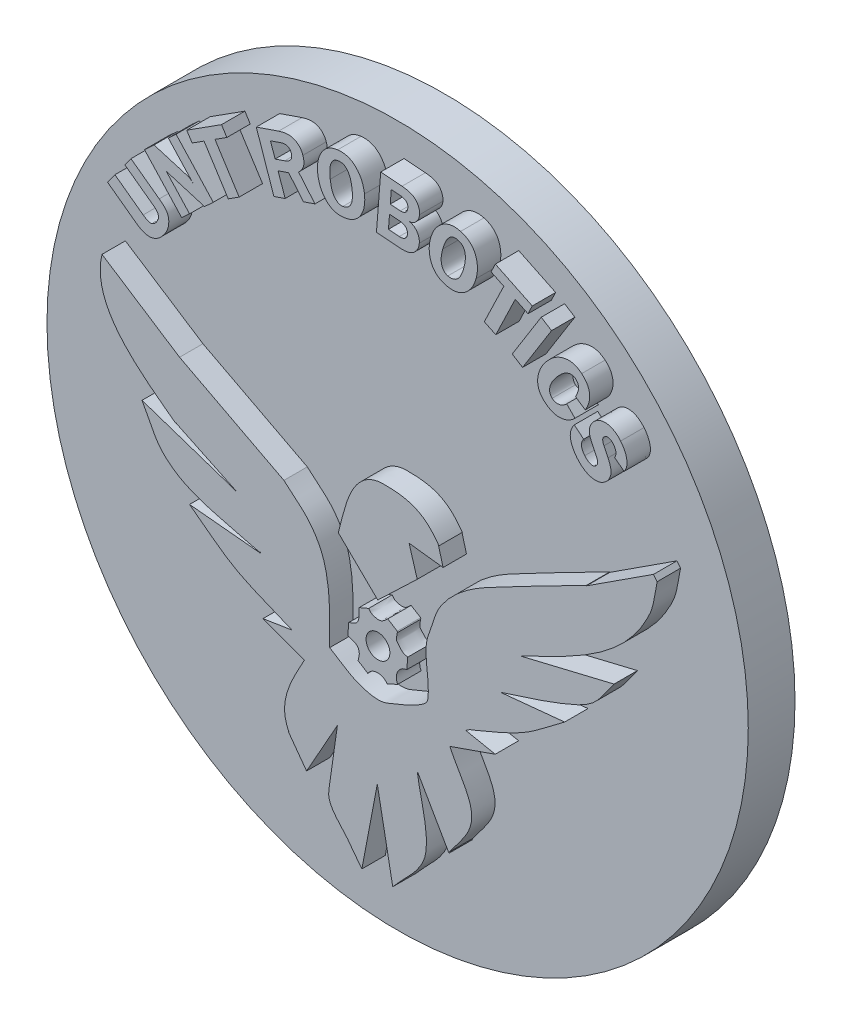
from build123d import *

# Parameters (mm, degrees)
SKETCH2_R           = 38.1
BOSS_EXTRUDE1_DEPTH = 5.08
SKETCH3_R           = 1.292496353
BOSS_EXTRUDE3_DEPTH = 7.62
BOSS_EXTRUDE4_START = 5.08
BOSS_EXTRUDE4_DEPTH = 2.54


# Read off the part's stored shape, not the designer's step: Boss-Extrude4
with BuildPart() as part:
    # Sketch2 → Boss-Extrude1 (new body)
    with BuildSketch(Plane.XY):
        Circle(SKETCH2_R)
    extrude(amount=BOSS_EXTRUDE1_DEPTH)

    # Sketch3 → Boss-Extrude3 (add)
    # profile 1 of 3: a face of its own
    with BuildSketch(Plane.XY):
        with BuildLine():
            Line((-29.579789435, 11.994593958), (-21.152724585, 6.524393967))
            Line((-21.152724585, 6.524393967), (-9.818075955, 0.610664247))
            add(Edge.make_bspline(
                [(-9.818075955, 0.610664247), (-8.832454335, -0.309249265), (-7.680186055, -1.078109033), (-6.861211095, -2.149076289), (-6.160574134, -3.065293853), (-5.62149609, -4.136912136), (-5.333497584, -5.253784392), (-4.716872773, -7.645085486), (-4.840686774, -10.176422886), (-4.840686774, -12.645946541)],
                knots=[0, 0, 0, 0, 1, 1, 1, 2, 2, 2, 3, 3, 3, 3], degree=3))
            add(Edge.make_bspline(
                [(-4.840686774, -12.645946541), (-3.740075965, -13.270173567), (-2.734323061, -14.10406992), (-1.538854347, -14.518627619), (-0.590080751, -14.847637818), (0.546369201, -15.116152984), (1.467291594, -14.715751943), (2.279139107, -14.362774764), (5.653781526, -13.159701472), (5.804026722, -12.251697893), (6.141960653, -10.209401527), (5.16459689, -7.976329672), (5.902588884, -6.042281688), (6.331063426, -4.919382888), (6.564686585, -3.689973106), (7.233178071, -2.69116818), (9.311738136, 0.414445094), (12.517591351, 1.658257001), (15.709524003, 3.370404783), (18.137433855, 4.672731907), (20.588132004, 5.932911487), (23.052405072, 7.16504802)],
                knots=[0, 0, 0, 0, 1, 1, 1, 2, 2, 2, 3, 3, 3, 4, 4, 4, 5, 5, 5, 6, 6, 6, 7, 7, 7, 7], degree=3))
            Line((23.052405072, 7.16504802), (23.052405072, 7.115766939))
            Line((23.052405072, 7.115766939), (30.34600506, 11.846750715))
            Line((30.34600506, 11.846750715), (30.740253708, 11.353939905))
            add(Edge.make_bspline(
                [(30.740253708, 11.353939905), (30.477421276, 10.220475042), (30.427069176, 9.015572274), (29.951756412, 7.953545316), (27.30947276, 2.049692783), (21.252470912, -0.467924161), (15.808086165, -3.085416828)],
                knots=[0, 0, 0, 0, 1, 1, 1, 2, 2, 2, 2], degree=3))
            Line((15.808086165, -3.085416828), (26.058551013, -0.621362778))
            add(Edge.make_bspline(
                [(26.058551013, -0.621362778), (25.270053717, -1.606984398), (24.67788619, -2.788738172), (23.693059125, -3.578227638), (22.64409805, -4.419130317), (21.344216773, -4.903387233), (20.095540212, -5.401627635), (18.00156407, -6.237155061), (15.824513192, -6.847206011), (13.688999682, -7.569995199)],
                knots=[0, 0, 0, 0, 1, 1, 1, 2, 2, 2, 3, 3, 3, 3], degree=3))
            Line((13.688999682, -7.569995199), (20.686913184, -6.880060065))
            add(Edge.make_bspline(
                [(20.686913184, -6.880060065), (19.126345619, -7.997097901), (17.670505251, -9.277266864), (16.005210489, -10.231173572), (14.269890966, -11.225191552), (12.358410495, -11.873876272), (10.535010498, -12.695227622)],
                knots=[0, 0, 0, 0, 1, 1, 1, 2, 2, 2, 2], degree=3))
            Line((10.535010498, -12.695227622), (10.535010498, -12.645946541))
            Line((10.535010498, -12.645946541), (9.943637526, -13.040195189))
            Line((9.943637526, -13.040195189), (13.146907791, -13.680849242))
            Line((13.146907791, -13.680849242), (8.218799691, -15.405687077))
            add(Edge.make_bspline(
                [(8.218799691, -15.405687077), (9.346089072, -17.942088186), (11.523950006, -19.923386326), (10.14076185, -22.551443822), (9.597337501, -23.583950085), (8.793745636, -24.456978954), (8.120237529, -25.40974652)],
                knots=[0, 0, 0, 0, 1, 1, 1, 2, 2, 2, 2], degree=3))
            Line((8.120237529, -25.40974652), (8.070956448, -25.40974652))
            Line((8.070956448, -25.40974652), (8.120237529, -25.508308682))
            Line((8.120237529, -25.508308682), (4.670561859, -19.4960168))
            add(Edge.make_bspline(
                [(4.670561859, -19.4960168), (4.982675372, -21.877935715), (5.906233069, -24.258214502), (5.606902398, -26.641773545), (5.348495949, -28.69945453), (3.322619265, -30.112658935), (2.009383485, -31.717724888)],
                knots=[0, 0, 0, 0, 1, 1, 1, 2, 2, 2, 2], degree=3))
            Line((2.009383485, -31.717724888), (0.333826731, -22.896411389))
            Line((0.333826731, -22.896411389), (-1.341730023, -31.717724888))
            add(Edge.make_bspline(
                [(-1.341730023, -31.717724888), (-1.752405698, -31.175632997), (-2.190303981, -30.653126947), (-2.573757048, -30.091449215), (-3.429932635, -28.837332863), (-5.118507738, -27.706126684), (-4.939248936, -26.198243816), (-4.674875738, -23.974398684), (-4.31502191, -21.762946526), (-4.002908397, -19.545297881)],
                knots=[0, 0, 0, 0, 1, 1, 1, 2, 2, 2, 3, 3, 3, 3], degree=3))
            Line((-4.002908397, -19.545297881), (-7.354021905, -25.508308682))
            Line((-7.354021905, -25.508308682), (-9.325265145, -22.797849227))
            Line((-9.325265145, -22.797849227), (-9.275984064, -22.797849227))
            add(Edge.make_bspline(
                [(-9.275984064, -22.797849227), (-10.581822269, -20.186172817), (-8.826145229, -17.537426801), (-7.60042731, -15.208562753)],
                knots=[0, 0, 0, 0, 1, 1, 1, 1], degree=3))
            Line((-7.60042731, -15.208562753), (-12.085005681, -13.533005999))
            Line((-12.085005681, -13.533005999), (-8.931016497, -13.040195189))
            add(Edge.make_bspline(
                [(-8.931016497, -13.040195189), (-10.984394872, -12.136708704), (-13.135434511, -11.428744907), (-15.091151622, -10.329735734), (-16.867447744, -9.33155163), (-18.409411076, -7.964243847), (-20.068540803, -6.781497903)],
                knots=[0, 0, 0, 0, 1, 1, 1, 2, 2, 2, 2], degree=3))
            Line((-20.068540803, -6.781497903), (-12.380692167, -7.520714118))
            Line((-12.380692167, -7.520714118), (-12.371497121, -7.402679297))
            add(Edge.make_bspline(
                [(-12.371497121, -7.402679297), (-12.420778202, -7.419106324), (-12.468495303, -7.462602367), (-12.519340364, -7.451960378), (-13.182278851, -7.313205811), (-13.836706952, -7.135743992), (-14.490583604, -6.959149568), (-17.354616174, -6.185651721), (-20.684874928, -5.68059061), (-22.917648455, -3.410911736), (-23.966733646, -2.344486294), (-24.461788993, -0.848295524), (-25.233859262, 0.433012582)],
                knots=[0, 0, 0, 0, 1, 1, 1, 2, 2, 2, 3, 3, 3, 4, 4, 4, 4], degree=3))
            Line((-25.233859262, 0.433012582), (-14.894027298, -3.036135747))
            Line((-14.894027298, -3.036135747), (-21.497692152, 0.117853437))
            Line((-21.497692152, 0.117853437), (-21.497692152, 0.167134518))
            Line((-21.497692152, 0.167134518), (-21.596254314, 0.117853437))
            add(Edge.make_bspline(
                [(-21.596254314, 0.117853437), (-25.210184702, 2.838452718), (-30.876146829, 6.623970472), (-29.579789435, 11.994593958)],
                knots=[0, 0, 0, 0, 1, 1, 1, 1], degree=3))
        make_face()
    # profile 2 of 3: a face of its own
    with BuildSketch(Plane.XY):
        with BuildLine():
            Line((7.036053747, 2.877593973), (6.986772666, 2.877593973))
            Line((6.986772666, 2.877593973), (7.479583476, 1.054193976))
            Line((7.479583476, 1.054193976), (3.783502401, 1.497723705))
            Line((3.783502401, 1.497723705), (4.670561859, -1.459141155))
            Line((4.670561859, -1.459141155), (0.383107812, -5.549470878))
            Line((0.383107812, -5.549470878), (-3.904346235, -1.360578993))
            add(Edge.make_bspline(
                [(-3.904346235, -1.360578993), (-3.212855949, 1.185362513), (-2.58298743, 5.752485635), (1.171605108, 5.68661559), (3.858933067, 5.639469486), (5.446132093, 5.148910621), (7.036053747, 2.877593973)],
                knots=[0, 0, 0, 0, 1, 1, 1, 2, 2, 2, 2], degree=3))
        make_face()
    # profile 3 of 3: a face of its own
    with BuildSketch(Plane.XY):
        with BuildLine():
            Line((1.467291594, -6.781497903), (2.502194295, -7.422151956))
            Line((2.502194295, -7.422151956), (2.452913214, -7.422151956))
            Line((2.452913214, -7.422151956), (2.551475376, -7.520714118))
            add(Edge.make_bspline(
                [(2.551475376, -7.520714118), (2.535048349, -7.537141145), (2.504908672, -7.546922995), (2.502194295, -7.569995199), (2.467645917, -7.863656411), (2.308540186, -8.233607607), (2.502194295, -8.457054656), (2.692532681, -8.67667587), (2.859854561, -8.924964535), (3.093567267, -9.097708709), (3.248188965, -9.211994312), (3.454961861, -9.229124925), (3.635659158, -9.294833033)],
                knots=[0, 0, 0, 0, 1, 1, 1, 2, 2, 2, 3, 3, 3, 4, 4, 4, 4], degree=3))
            Line((3.635659158, -9.294833033), (3.537096996, -10.526860058))
            ThreePointArc((3.537096996, -10.526860058), (2.546876855, -11.201406213), (2.551475376, -12.399541136))
            Line((2.551475376, -12.399541136), (1.418010513, -12.941633027))
            ThreePointArc((1.418010513, -12.941633027), (0.345260372, -12.398376883), (-0.70107597, -12.990914108))
            Line((-0.70107597, -12.990914108), (-1.785259752, -12.300978974))
            add(Edge.make_bspline(
                [(-1.785259752, -12.300978974), (-1.768832725, -12.284551947), (-1.740015934, -12.27457572), (-1.735978671, -12.251697893), (-1.689946785, -11.99085054), (-1.590853462, -11.723953659), (-1.637416509, -11.463200597), (-1.769494749, -10.723562451), (-2.254472199, -10.809705185), (-2.820162453, -10.526860058), (-2.853016507, -10.510433031), (-2.870855257, -10.465002707), (-2.869443534, -10.428297896), (-2.854238807, -10.032974988), (-2.803735426, -9.6398006), (-2.770881372, -9.245551952)],
                knots=[0, 0, 0, 0, 1, 1, 1, 2, 2, 2, 3, 3, 3, 4, 4, 4, 5, 5, 5, 5], degree=3))
            add(Edge.make_bspline(
                [(-2.770881372, -9.245551952), (-2.200412948, -8.995972017), (-1.828038038, -9.02481175), (-1.68669759, -8.358492494), (-1.611629261, -8.004598943), (-1.653843536, -7.635703307), (-1.637416509, -7.274308713)],
                knots=[0, 0, 0, 0, 1, 1, 1, 2, 2, 2, 2], degree=3))
            Line((-1.637416509, -7.274308713), (-0.602513808, -6.830778984))
            add(Edge.make_bspline(
                [(-0.602513808, -6.830778984), (-0.487524619, -6.945768173), (-0.406394104, -7.110253491), (-0.257546241, -7.175746551), (0.562591206, -7.536607027), (0.867150219, -7.381639278), (1.467291594, -6.781497903)],
                knots=[0, 0, 0, 0, 1, 1, 1, 2, 2, 2, 2], degree=3))
        make_face()
        with Locations(Location((0.404121802, -9.871569397, 0), (0, 0, 180))):
            Circle(SKETCH3_R, mode=Mode.SUBTRACT)
    extrude(amount=BOSS_EXTRUDE3_DEPTH)

    # Boss-Extrude4 outline → Boss-Extrude4 (add)
    # profile 1 of 11: a face of its own
    with BuildSketch(Plane.XY.offset(BOSS_EXTRUDE4_START)):
        with BuildLine():
            add(Edge.make_bspline(
                [(-23.680980567, 17.961880263), (-23.640735418, 18.020268201), (-23.563844323, 18.131822326), (-23.4872939, 18.31258876), (-23.443722883, 18.490661481), (-23.441334989, 18.639434116), (-23.459993479, 18.757704652), (-23.495267313, 18.847211567), (-23.543719382, 18.938714431), (-23.607878264, 19.032434303), (-23.690503699, 19.125491889), (-23.78690154, 19.222404645), (-23.900716264, 19.320062574), (-23.983893094, 19.383085736), (-24.027391408, 19.416044449)],
                knots=[0, 0, 0, 0, 0.122556034, 0.234151634, 0.337941542, 0.438326796, 0.489639227, 0.544348943, 0.603996729, 0.668823775, 0.740504836, 0.81925141, 0.905475371, 1, 1, 1, 1], degree=3))
            add(Edge.make_bspline(
                [(-25.107228862, 17.941577796), (-25.058888816, 17.90730741), (-24.966985635, 17.842153198), (-24.831057702, 17.755800973), (-24.702979004, 17.688638996), (-24.583923333, 17.636855363), (-24.47382056, 17.600125667), (-24.37164163, 17.581223344), (-24.277908015, 17.580757148), (-24.166305715, 17.601684928), (-24.041280698, 17.655182209), (-23.903134863, 17.734301983), (-23.781683311, 17.837839311), (-23.714857026, 17.920152818), (-23.680980567, 17.961880263)],
                knots=[0, 0, 0, 0, 0.10811187, 0.205540245, 0.29356548, 0.371693945, 0.442226528, 0.504903624, 0.560468589, 0.612238188, 0.710978135, 0.80680396, 0.902062523, 1, 1, 1, 1], degree=3))
            Line((-25.107228862, 17.941577796), (-28.177976969, 20.187538189))
            Line((-28.177976969, 20.187538189), (-28.982462217, 19.087398268))
            Line((-28.982462217, 19.087398268), (-25.849537805, 16.795757325))
            add(Edge.make_bspline(
                [(-22.847310524, 17.215764607), (-22.883158849, 17.167975521), (-22.953399365, 17.074338512), (-23.065410964, 16.943936562), (-23.178794835, 16.824010882), (-23.293435231, 16.71431137), (-23.412482597, 16.61832524), (-23.531116999, 16.5307716), (-23.654095836, 16.457352651), (-23.777736194, 16.393837711), (-23.902980441, 16.341445837), (-24.028214115, 16.299924041), (-24.153094224, 16.267315104), (-24.278457545, 16.247250208), (-24.403628137, 16.237001801), (-24.529222586, 16.2371499), (-24.654547282, 16.246805368), (-24.780043897, 16.26907766), (-24.90605839, 16.301546412), (-25.034957713, 16.341663153), (-25.16498662, 16.394309062), (-25.297601078, 16.455954821), (-25.433314621, 16.525050847), (-25.570525973, 16.605818404), (-25.710394095, 16.695766754), (-25.802454079, 16.761922316), (-25.849537805, 16.795757325)],
                knots=[0, 0, 0, 0, 0.051469454, 0.100848252, 0.148031205, 0.19366835, 0.237445239, 0.279732496, 0.320614041, 0.360714694, 0.399434909, 0.437471442, 0.474335537, 0.510528608, 0.546730855, 0.582450988, 0.618653235, 0.654906822, 0.692124206, 0.730741351, 0.771148939, 0.812898691, 0.856749869, 0.902322925, 0.950043433, 1, 1, 1, 1], degree=3))
            add(Edge.make_bspline(
                [(-23.363754523, 20.32457984), (-23.31491398, 20.288044668), (-23.219578085, 20.216728645), (-23.083880044, 20.10835118), (-22.960913968, 20.00009583), (-22.848676685, 19.894805479), (-22.747920701, 19.791302908), (-22.660746564, 19.687653608), (-22.582268634, 19.588157646), (-22.516536193, 19.487514414), (-22.460598244, 19.384269112), (-22.414945838, 19.274526474), (-22.378490725, 19.157651591), (-22.350059145, 19.033870889), (-22.332975887, 18.902582757), (-22.324166074, 18.763974532), (-22.324434586, 18.618186814), (-22.333403002, 18.466514701), (-22.351154404, 18.31089426), (-22.385472414, 18.154763732), (-22.429357452, 17.997432303), (-22.488401244, 17.841017464), (-22.55833948, 17.68337092), (-22.642469101, 17.527123535), (-22.737808144, 17.369383643), (-22.81024966, 17.267756665), (-22.847310524, 17.215764607)],
                knots=[0, 0, 0, 0, 0.050543906, 0.098660829, 0.143867043, 0.186267102, 0.226177499, 0.263473421, 0.29845771, 0.331122863, 0.362957538, 0.395635852, 0.429446849, 0.464309771, 0.500744216, 0.539028454, 0.579337045, 0.621469685, 0.664901757, 0.708967088, 0.753791208, 0.800148656, 0.847375176, 0.896611467, 0.947106736, 1, 1, 1, 1], degree=3))
            Line((-23.363754523, 20.32457984), (-26.43450263, 22.570540232))
            Line((-26.43450263, 22.570540232), (-27.098139515, 21.662004842))
            Line((-27.098139515, 21.662004842), (-24.027391408, 19.416044449))
        make_face()
    # profile 2 of 11: a face of its own
    with BuildSketch(Plane.XY.offset(BOSS_EXTRUDE4_START)):
        with BuildLine():
            add(Edge.make_bspline(
                [(-20.093733597, 23.971069106), (-20.088181111, 23.968200148), (-20.072615204, 23.960157277), (-20.045051926, 23.940475081), (-20.007511207, 23.909763655), (-19.958804463, 23.868779321), (-19.899734475, 23.817002693), (-19.829998695, 23.754761662), (-19.749687151, 23.682408557), (-19.693512287, 23.629835623), (-19.663575082, 23.601817991)],
                knots=[0, 0, 0, 0, 0.033000081, 0.092512812, 0.178380533, 0.28941539, 0.428815, 0.593451701, 0.783338686, 1, 1, 1, 1], degree=3))
            Line((-20.093733597, 23.971069106), (-23.92582421, 25.113082865))
            Line((-23.92582421, 25.113082865), (-24.963787827, 24.156329116))
            Line((-24.963787827, 24.156329116), (-20.922328025, 19.772265186))
            Line((-20.922328025, 19.772265186), (-20.06708661, 20.561523584))
            Line((-20.06708661, 20.561523584), (-22.592560786, 23.301668695))
            add(Edge.make_bspline(
                [(-22.5858614, 23.299818797), (-22.588094555, 23.300435337), (-22.590327711, 23.301051877), (-22.592560786, 23.301668695)],
                knots=[0, 0, 0, 0, 0.02165875, 0.02165875, 0.02165875, 0.02165875], degree=3))
            Line((-22.5858614, 23.299818797), (-18.440351456, 22.060099416))
            Line((-18.440351456, 22.060099416), (-17.489942227, 22.936912202))
            Line((-17.489942227, 22.936912202), (-21.531402029, 27.320976132))
            Line((-21.531402029, 27.320976132), (-22.375223307, 26.543137872))
            Line((-22.375223307, 26.543137872), (-19.663575082, 23.601817991))
        make_face()
    # profile 3 of 11: a face of its own
    with BuildSketch(Plane.XY.offset(BOSS_EXTRUDE4_START)):
        with BuildLine():
            add(Edge.make_bspline(
                [(-7.754024273, 32.22764358), (-7.739406194, 32.183422638), (-7.710710999, 32.096617209), (-7.679644881, 31.965341635), (-7.656059023, 31.837516427), (-7.643695462, 31.712326263), (-7.639224509, 31.58975969), (-7.645913617, 31.469690174), (-7.660981533, 31.352582324), (-7.685222047, 31.238312544), (-7.719481979, 31.126589822), (-7.764000215, 31.017627221), (-7.817839956, 30.911770025), (-7.880066173, 30.808318), (-7.952914435, 30.708314733), (-8.034375614, 30.610103607), (-8.125450658, 30.514971755), (-8.192212966, 30.45579698), (-8.226056626, 30.425799649)],
                knots=[0, 0, 0, 0, 0.069966025, 0.137342863, 0.20255891, 0.265179739, 0.326235494, 0.386709356, 0.445687968, 0.503538989, 0.56205329, 0.62107642, 0.680208992, 0.74038812, 0.802314618, 0.865962742, 0.932052807, 1, 1, 1, 1], degree=3))
            add(Edge.make_bspline(
                [(-10.388269343, 33.186935137), (-10.301922916, 33.215223599), (-10.134537932, 33.270061579), (-9.885880792, 33.329665367), (-9.649991824, 33.367687334), (-9.427285216, 33.388895719), (-9.216376316, 33.384492584), (-9.017833193, 33.361657719), (-8.832033861, 33.315645804), (-8.660032082, 33.249084637), (-8.501379624, 33.165904093), (-8.354076061, 33.070729602), (-8.220942445, 32.961258153), (-8.100475249, 32.839756896), (-7.99339317, 32.705686663), (-7.89905273, 32.558603024), (-7.817320452, 32.398912721), (-7.775304389, 32.285224106), (-7.754024273, 32.22764358)],
                knots=[0, 0, 0, 0, 0.08587749, 0.166475936, 0.241420157, 0.311655801, 0.377646951, 0.440489253, 0.500232222, 0.558082337, 0.61442148, 0.669323163, 0.723596508, 0.777038528, 0.830808673, 0.88549294, 0.942004951, 1, 1, 1, 1], degree=3))
            Line((-10.388269343, 33.186935137), (-12.816951937, 32.353265093))
            Line((-12.816951937, 32.353265093), (-10.903444439, 26.777700142))
            Line((-10.903444439, 26.777700142), (-9.684027525, 27.19643852))
            Line((-9.684027525, 27.19643852), (-10.447907839, 29.420827542))
            Line((-10.447907839, 29.420827542), (-9.295742847, 29.81545674))
            Line((-9.295742847, 29.81545674), (-7.691847968, 27.880377871))
            Line((-7.691847968, 27.880377871), (-6.44070845, 28.309267483))
            Line((-6.44070845, 28.309267483), (-8.226056626, 30.425799649))
        make_face()
        with BuildLine():
            add(Edge.make_bspline(
                [(-9.720825746, 30.725261035), (-9.680942681, 30.739723462), (-9.603833827, 30.767684734), (-9.494055602, 30.813775479), (-9.396353701, 30.866486699), (-9.308403933, 30.920850564), (-9.230129394, 30.977886607), (-9.162486097, 31.03907121), (-9.104506089, 31.103601151), (-9.044603816, 31.194966644), (-8.988618278, 31.316330728), (-8.961562899, 31.474397768), (-8.966945941, 31.641066133), (-8.999585421, 31.749760048), (-9.016583928, 31.806367393)],
                knots=[0, 0, 0, 0, 0.086628455, 0.167485143, 0.242826307, 0.313043056, 0.378510111, 0.44026593, 0.499007129, 0.555058234, 0.662918261, 0.769133709, 0.879765782, 1, 1, 1, 1], degree=3))
            Line((-9.720825746, 30.725261035), (-10.771478404, 30.364892249))
            Line((-10.771478404, 30.364892249), (-11.275233362, 31.831745477))
            Line((-11.275233362, 31.831745477), (-10.145908645, 32.218761251))
            add(Edge.make_bspline(
                [(-9.016583928, 31.806367393), (-9.036356278, 31.856595809), (-9.074700327, 31.954002589), (-9.168386005, 32.078505455), (-9.283672512, 32.17909334), (-9.398470397, 32.238919779), (-9.498916251, 32.272306724), (-9.579708467, 32.289985701), (-9.664258725, 32.3007402), (-9.75314744, 32.299661649), (-9.845600795, 32.29210831), (-9.942769638, 32.276637519), (-10.043867059, 32.252884768), (-10.111386732, 32.230305653), (-10.145908645, 32.218761251)],
                knots=[0, 0, 0, 0, 0.118914062, 0.23060723, 0.340694581, 0.454928492, 0.514090449, 0.574460291, 0.637579473, 0.702124327, 0.770641179, 0.842614806, 0.919531039, 1, 1, 1, 1], degree=3))
        make_face(mode=Mode.SUBTRACT)
    # profile 4 of 11: a face of its own
    with BuildSketch(Plane.XY.offset(BOSS_EXTRUDE4_START)):
        with BuildLine():
            add(Edge.make_bspline(
                [(-1.06140171, 31.933726888), (-1.050525044, 31.825977007), (-1.029193046, 31.614651202), (-1.024480756, 31.301533947), (-1.042602357, 31.000566275), (-1.086480415, 30.71162396), (-1.151430593, 30.434749011), (-1.242269802, 30.170056495), (-1.357293819, 29.918077397), (-1.493029915, 29.678782062), (-1.651241798, 29.458068928), (-1.829335507, 29.259775021), (-2.027686582, 29.08767507), (-2.24395706, 28.938826162), (-2.479971124, 28.815242928), (-2.735428383, 28.718359685), (-3.008895659, 28.642779751), (-3.199513616, 28.615543759), (-3.297210869, 28.60158452)],
                knots=[0, 0, 0, 0, 0.071939691, 0.141092622, 0.20784005, 0.272077221, 0.335070038, 0.396579298, 0.457711074, 0.518895167, 0.579113559, 0.637820007, 0.695593874, 0.753208215, 0.811920719, 0.872157475, 0.934476983, 1, 1, 1, 1], degree=3))
            add(Edge.make_bspline(
                [(-3.982419124, 34.627610454), (-3.883968578, 34.636721882), (-3.691519013, 34.654532755), (-3.407197103, 34.648349798), (-3.13645771, 34.611666328), (-2.87939064, 34.545707154), (-2.636209392, 34.449472481), (-2.405859496, 34.324696674), (-2.190765392, 34.167785802), (-1.989603949, 33.985275492), (-1.806217131, 33.780461953), (-1.640036768, 33.559785876), (-1.494153417, 33.324219453), (-1.366599817, 33.07492643), (-1.259992847, 32.810585197), (-1.172298552, 32.531945735), (-1.104750997, 32.238227376), (-1.076009763, 32.036338935), (-1.06140171, 31.933726888)],
                knots=[0, 0, 0, 0, 0.066411454, 0.129820056, 0.190646971, 0.249666808, 0.307734204, 0.365995414, 0.42524756, 0.48622839, 0.548223167, 0.609739667, 0.67166271, 0.734212899, 0.797717649, 0.86299013, 0.930363208, 1, 1, 1, 1], degree=3))
            add(Edge.make_bspline(
                [(-6.140825128, 31.3297285), (-6.15131364, 31.433675597), (-6.171956081, 31.638253903), (-6.174872615, 31.941637432), (-6.157000427, 32.234988281), (-6.1129987, 32.517482573), (-6.048756481, 32.790794326), (-5.960145106, 33.054085109), (-5.845724767, 33.305914617), (-5.7129399, 33.546793542), (-5.557354618, 33.768915092), (-5.385043968, 33.969616322), (-5.193721775, 34.144262577), (-4.985414128, 34.292973349), (-4.759034276, 34.416223617), (-4.515805636, 34.513509391), (-4.255483611, 34.587176302), (-4.07460173, 34.613960472), (-3.982419124, 34.627610454)],
                knots=[0, 0, 0, 0, 0.070984718, 0.13970504, 0.205972839, 0.270544299, 0.333794556, 0.396619949, 0.45903348, 0.521586582, 0.583320961, 0.643040756, 0.701041594, 0.758962567, 0.816602422, 0.875811351, 0.936709895, 1, 1, 1, 1], degree=3))
            add(Edge.make_bspline(
                [(-3.297210869, 28.60158452), (-3.392707528, 28.59288319), (-3.579282573, 28.575883107), (-3.85518653, 28.583447412), (-4.118013415, 28.62120884), (-4.368047625, 28.689219203), (-4.605175725, 28.785319697), (-4.828163289, 28.913331421), (-5.038713544, 29.068538599), (-5.232884168, 29.25363212), (-5.411977242, 29.45899846), (-5.571884977, 29.682530713), (-5.715079913, 29.919811071), (-5.839483455, 30.172214088), (-5.94332248, 30.440523992), (-6.029684431, 30.722861278), (-6.097669499, 31.02056356), (-6.126264616, 31.225417662), (-6.140825128, 31.3297285)],
                knots=[0, 0, 0, 0, 0.064956349, 0.12690741, 0.186590585, 0.244525246, 0.302131236, 0.359526375, 0.41835856, 0.479001515, 0.540979769, 0.602803991, 0.665051546, 0.728647887, 0.793282021, 0.859848275, 0.928635338, 1, 1, 1, 1], degree=3))
        make_face()
        with BuildLine():
            add(Edge.make_bspline(
                [(-4.784366564, 31.46042563), (-4.773105651, 31.377862798), (-4.751327862, 31.218192277), (-4.710257314, 30.987920574), (-4.65916968, 30.776408613), (-4.602767394, 30.581847431), (-4.536949949, 30.405423591), (-4.463722808, 30.246663901), (-4.383617525, 30.104996192), (-4.294956838, 29.981707934), (-4.199353947, 29.87600861), (-4.099587599, 29.786084717), (-3.995941119, 29.711393866), (-3.886186963, 29.655881651), (-3.77407827, 29.61196123), (-3.655639815, 29.589023282), (-3.533206399, 29.578886098), (-3.450730135, 29.586298945), (-3.408874437, 29.590060874)],
                knots=[0, 0, 0, 0, 0.096568346, 0.186756169, 0.270934166, 0.348640455, 0.42138937, 0.488938478, 0.551077296, 0.609714494, 0.664550604, 0.715925249, 0.765159927, 0.812077982, 0.858148457, 0.904198063, 0.951381685, 1, 1, 1, 1], degree=3))
            add(Edge.make_bspline(
                [(-3.879637886, 33.639134101), (-3.9259737, 33.631771041), (-4.016483943, 33.61738838), (-4.145548929, 33.577822054), (-4.263760811, 33.523184718), (-4.369906006, 33.452109983), (-4.466429116, 33.368009481), (-4.550527295, 33.267277191), (-4.624566884, 33.15236168), (-4.686397565, 33.022069321), (-4.736913679, 32.877269279), (-4.777315596, 32.718519164), (-4.806257936, 32.544920091), (-4.823161844, 32.356614519), (-4.830851665, 32.153302579), (-4.826520661, 31.935186703), (-4.810995481, 31.70237758), (-4.79343769, 31.542846429), (-4.784366564, 31.46042563)],
                knots=[0, 0, 0, 0, 0.05310124, 0.103725513, 0.152386432, 0.200096743, 0.247967999, 0.29692762, 0.34823217, 0.402454427, 0.459892659, 0.521720185, 0.587812373, 0.659045815, 0.735766581, 0.81819601, 0.906072074, 1, 1, 1, 1], degree=3))
            add(Edge.make_bspline(
                [(-2.417860275, 31.777651674), (-2.428132656, 31.855168073), (-2.448073352, 32.005642523), (-2.489025969, 32.222812062), (-2.536439037, 32.425633183), (-2.594341452, 32.613241339), (-2.656301202, 32.787973971), (-2.729711562, 32.946653274), (-2.807284314, 33.092589768), (-2.895398167, 33.222287656), (-2.989917149, 33.337335575), (-3.093361408, 33.43482916), (-3.204646296, 33.514492277), (-3.324169515, 33.576439627), (-3.452153449, 33.619655642), (-3.587943379, 33.644843356), (-3.731775773, 33.652867674), (-3.82935155, 33.643804743), (-3.879637886, 33.639134101)],
                knots=[0, 0, 0, 0, 0.088112542, 0.171043629, 0.248973844, 0.32271489, 0.392236617, 0.457727221, 0.519588382, 0.578292453, 0.634139884, 0.687088157, 0.73801502, 0.787905027, 0.838255235, 0.889677225, 0.943144412, 1, 1, 1, 1], degree=3))
            add(Edge.make_bspline(
                [(-3.408874437, 29.590060874), (-3.366772235, 29.596171298), (-3.2835601, 29.608248134), (-3.163767199, 29.645037999), (-3.050183149, 29.692803942), (-2.943858604, 29.755082824), (-2.843180864, 29.828282346), (-2.750219655, 29.916222418), (-2.662094414, 30.015205608), (-2.58099765, 30.129220689), (-2.510717524, 30.261433576), (-2.45314494, 30.414242931), (-2.412735715, 30.589240891), (-2.385293132, 30.785402959), (-2.372173636, 31.002988218), (-2.372436301, 31.242398682), (-2.388497139, 31.503204389), (-2.407821494, 31.683822586), (-2.417860275, 31.777651674)],
                knots=[0, 0, 0, 0, 0.047128285, 0.093145846, 0.13854941, 0.183534095, 0.229515765, 0.276323008, 0.325182712, 0.376342294, 0.431125532, 0.490816115, 0.556931695, 0.629918397, 0.710313366, 0.798518508, 0.895332669, 1, 1, 1, 1], degree=3))
        make_face(mode=Mode.SUBTRACT)
    # profile 5 of 11: a face of its own
    with BuildSketch(Plane.XY.offset(BOSS_EXTRUDE4_START)):
        with BuildLine():
            add(Edge.make_bspline(
                [(4.895982404, 30.28057041), (4.890211385, 30.225445672), (4.878805852, 30.116500088), (4.844557705, 29.957265842), (4.793986288, 29.805763352), (4.732648605, 29.659937199), (4.653861937, 29.522533102), (4.562811074, 29.390750861), (4.454724339, 29.268341991), (4.336705175, 29.150496059), (4.201832317, 29.045849162), (4.050358515, 28.958317478), (3.884733702, 28.885233567), (3.70296479, 28.831366725), (3.506198591, 28.793370679), (3.294297056, 28.772692084), (3.066903823, 28.767344744), (2.910959107, 28.776996578), (2.830206405, 28.781994578)],
                knots=[0, 0, 0, 0, 0.057630625, 0.113898084, 0.168997378, 0.223593697, 0.278168737, 0.333462689, 0.389920778, 0.447792761, 0.506758327, 0.566902265, 0.629357962, 0.694638681, 0.763671252, 0.837529737, 0.91586818, 1, 1, 1, 1], degree=3))
            add(Edge.make_bspline(
                [(3.779346729, 31.786759668), (3.82434165, 31.778198501), (3.912728898, 31.761381093), (4.04045351, 31.723842588), (4.159140654, 31.67175499), (4.2709355, 31.611451371), (4.375258081, 31.539703855), (4.470107948, 31.455705955), (4.557248156, 31.360520018), (4.635992771, 31.256009122), (4.707000862, 31.145140114), (4.766736995, 31.02952086), (4.814690974, 30.911185506), (4.853626883, 30.790464911), (4.881316636, 30.666889352), (4.897953354, 30.540352611), (4.903092811, 30.411225062), (4.898375516, 30.324544151), (4.895982404, 30.28057041)],
                knots=[0, 0, 0, 0, 0.066476652, 0.13058559, 0.192750611, 0.254303033, 0.314770814, 0.376117677, 0.437829165, 0.501814471, 0.565864567, 0.62875623, 0.690446329, 0.751035585, 0.812710402, 0.874023451, 0.936091348, 1, 1, 1, 1], degree=3))
            add(Edge.make_bspline(
                [(4.921360488, 32.975722881), (4.917378245, 32.936289996), (4.909493104, 32.85820992), (4.886023981, 32.743709247), (4.854855174, 32.632551406), (4.812051428, 32.526209242), (4.762981004, 32.422406016), (4.702901064, 32.323052579), (4.632655994, 32.228377863), (4.556067226, 32.137592033), (4.473733975, 32.053661345), (4.383888991, 31.983168314), (4.292544311, 31.921179958), (4.196761309, 31.871268583), (4.097289345, 31.833664327), (3.99482153, 31.804426686), (3.888053525, 31.789853827), (3.815757157, 31.78779603), (3.779346729, 31.786759668)],
                knots=[0, 0, 0, 0, 0.065668615, 0.130028792, 0.193504279, 0.256789689, 0.319829874, 0.383687665, 0.44890546, 0.515077575, 0.580528682, 0.643389209, 0.704068567, 0.763346024, 0.821947718, 0.880128357, 0.939629362, 1, 1, 1, 1], degree=3))
            add(Edge.make_bspline(
                [(3.019273127, 34.703970369), (3.115860909, 34.695115511), (3.301797702, 34.67806942), (3.567467069, 34.632711265), (3.808617943, 34.571335189), (3.99474828, 34.509615341), (4.131223032, 34.447963459), (4.226697203, 34.394424237), (4.317647714, 34.333032545), (4.403673401, 34.263245814), (4.485531747, 34.185138592), (4.562657432, 34.098956768), (4.635170882, 34.004783518), (4.701679281, 33.90360381), (4.763143575, 33.798038163), (4.813130196, 33.687474734), (4.855517691, 33.575267441), (4.889024556, 33.460458486), (4.911660207, 33.342758913), (4.92408513, 33.222201366), (4.928293712, 33.099599852), (4.923679722, 33.017160993), (4.921360488, 32.975722881)],
                knots=[0, 0, 0, 0, 0.099814688, 0.192148766, 0.277047534, 0.355804086, 0.393601844, 0.431026654, 0.46833987, 0.506417429, 0.544910879, 0.584683109, 0.625350798, 0.667131238, 0.709252823, 0.750942426, 0.791861038, 0.83264741, 0.87388902, 0.915045513, 0.957297401, 1, 1, 1, 1], degree=3))
            Line((3.019273127, 34.703970369), (0.702254101, 34.885423667))
            Line((0.702254101, 34.885423667), (0.240372981, 28.985019246))
            Line((0.240372981, 28.985019246), (2.830206405, 28.781994578))
        make_face()
        with BuildLine():
            add(Edge.make_bspline(
                [(2.717273933, 29.821227098), (2.779941439, 29.818164688), (2.899134343, 29.812340019), (3.069215207, 29.838515752), (3.220242381, 29.888846024), (3.350346231, 29.967135183), (3.457463363, 30.069746258), (3.537446847, 30.194682012), (3.590883113, 30.339417305), (3.603834385, 30.443383048), (3.610582473, 30.497553024)],
                knots=[0, 0, 0, 0, 0.148187288, 0.281850586, 0.404697538, 0.522827591, 0.638240859, 0.752655387, 0.871124359, 1, 1, 1, 1], degree=3))
            Line((2.717273933, 29.821227098), (1.54353757, 29.913857103))
            Line((1.54353757, 29.913857103), (1.660276754, 31.399743894))
            Line((1.660276754, 31.399743894), (2.83781983, 31.307113889))
            add(Edge.make_bspline(
                [(3.610582473, 30.497553024), (3.611850828, 30.55012765), (3.614300651, 30.651675343), (3.582943355, 30.799687273), (3.520557358, 30.934229704), (3.42924993, 31.053925838), (3.313874004, 31.156071715), (3.173944498, 31.233378769), (3.013208569, 31.285768248), (2.897846615, 31.299808345), (2.83781983, 31.307113889)],
                knots=[0, 0, 0, 0, 0.125271633, 0.241961692, 0.357663857, 0.476657118, 0.599048937, 0.722965223, 0.855849293, 1, 1, 1, 1], degree=3))
        make_face(mode=Mode.SUBTRACT)
        with BuildLine():
            add(Edge.make_bspline(
                [(2.835282021, 32.295590242), (2.891615423, 32.293539368), (2.999131208, 32.289625148), (3.153851039, 32.316458165), (3.2913018, 32.371469388), (3.409548034, 32.454107426), (3.506535115, 32.558754424), (3.579663159, 32.682217431), (3.631207974, 32.821528104), (3.642711999, 32.921556949), (3.648649599, 32.973185073)],
                knots=[0, 0, 0, 0, 0.141459276, 0.269983788, 0.391649067, 0.510848615, 0.629763111, 0.747597716, 0.869727013, 1, 1, 1, 1], degree=3))
            Line((2.835282021, 32.295590242), (1.737679909, 32.381875726))
            Line((1.737679909, 32.381875726), (1.849343476, 33.808124021))
            Line((1.849343476, 33.808124021), (2.926643122, 33.723107441))
            add(Edge.make_bspline(
                [(3.648649599, 32.973185073), (3.649897464, 33.001932663), (3.65230225, 33.057332705), (3.649267052, 33.138669265), (3.635977266, 33.214159951), (3.617690803, 33.285361933), (3.589171049, 33.35041049), (3.553739196, 33.410051879), (3.510856065, 33.464860755), (3.44347364, 33.529553748), (3.34690386, 33.598156115), (3.218942696, 33.662873262), (3.076950575, 33.704978667), (2.977656365, 33.716954668), (2.926643122, 33.723107441)],
                knots=[0, 0, 0, 0, 0.073349049, 0.141352382, 0.206936498, 0.26840314, 0.328289152, 0.387275454, 0.444865669, 0.505100083, 0.62479929, 0.745345294, 0.869168984, 1, 1, 1, 1], degree=3))
        make_face(mode=Mode.SUBTRACT)
    # profile 6 of 11: a face of its own
    with BuildSketch(Plane.XY.offset(BOSS_EXTRUDE4_START)):
        with BuildLine():
            add(Edge.make_bspline(
                [(11.063018107, 30.028005041), (11.032468507, 29.923849193), (10.972615772, 29.719787199), (10.857487552, 29.428439524), (10.725573791, 29.157299196), (10.576534458, 28.905801615), (10.410737394, 28.673828522), (10.225034693, 28.463874757), (10.024640936, 28.271996136), (9.806319649, 28.104092949), (9.576949436, 27.959008063), (9.336538749, 27.843398673), (9.087491143, 27.759631268), (8.830041985, 27.703966878), (8.564169716, 27.680765675), (8.290285498, 27.686110478), (8.008071867, 27.721357603), (7.820562507, 27.768203938), (7.724531219, 27.792195882)],
                knots=[0, 0, 0, 0, 0.071993937, 0.141050422, 0.207576185, 0.27188212, 0.334818086, 0.396467412, 0.457612537, 0.518634512, 0.578907722, 0.637406202, 0.69518457, 0.752873573, 0.811773288, 0.871844902, 0.93436648, 1, 1, 1, 1], degree=3))
            add(Edge.make_bspline(
                [(9.379182265, 33.632961806), (9.474210202, 33.604526712), (9.659657578, 33.549035521), (9.920129026, 33.433684285), (10.156088577, 33.295729181), (10.37045038, 33.138260231), (10.559695476, 32.956092545), (10.725467797, 32.751993914), (10.867276734, 32.52565949), (10.982399404, 32.279337199), (11.075710986, 32.020496238), (11.145962441, 31.752953629), (11.191170518, 31.479352796), (11.214429301, 31.200114017), (11.212919798, 30.914798973), (11.186429118, 30.623531319), (11.139391242, 30.325814538), (11.088744405, 30.1283222), (11.063018107, 30.028005041)],
                knots=[0, 0, 0, 0, 0.066518608, 0.129811313, 0.190619193, 0.249662941, 0.307884187, 0.36640361, 0.425709481, 0.486656999, 0.548523698, 0.610145054, 0.672024775, 0.734399937, 0.797985411, 0.863236998, 0.930530592, 1, 1, 1, 1], degree=3))
            add(Edge.make_bspline(
                [(6.128249765, 31.399690456), (6.157986156, 31.500039815), (6.216434055, 31.697279928), (6.329276053, 31.978936201), (6.45691014, 32.243767205), (6.605095104, 32.488786007), (6.768423991, 32.717405986), (6.95127022, 32.925838522), (7.149527472, 33.118045385), (7.365971446, 33.287505978), (7.592462549, 33.436924363), (7.829427363, 33.555458501), (8.073157699, 33.643605618), (8.322315687, 33.704582859), (8.57906399, 33.731708575), (8.841203507, 33.730437715), (9.11025776, 33.698603651), (9.288199445, 33.655169824), (9.379182265, 33.632961806)],
                knots=[0, 0, 0, 0, 0.071062638, 0.139676057, 0.205853149, 0.270551078, 0.333945229, 0.396462793, 0.45864339, 0.521240791, 0.582923527, 0.642672843, 0.70075189, 0.758662971, 0.816473467, 0.875661966, 0.936425099, 1, 1, 1, 1], degree=3))
            add(Edge.make_bspline(
                [(7.724531219, 27.792195882), (7.632460482, 27.820256293), (7.453019655, 27.874944497), (7.200888671, 27.98844884), (6.971448134, 28.122117443), (6.765984627, 28.28038656), (6.583476287, 28.45976734), (6.42471442, 28.66252033), (6.289968237, 28.887427706), (6.178979409, 29.13209198), (6.092940715, 29.391189659), (6.0278812, 29.658558063), (5.985360957, 29.932770481), (5.968870428, 30.213853996), (5.971803144, 30.50155429), (6.001145853, 30.795790674), (6.051065649, 31.097078528), (6.10222537, 31.297657905), (6.128249765, 31.399690456)],
                knots=[0, 0, 0, 0, 0.065116898, 0.12690927, 0.18673438, 0.244532392, 0.3020466, 0.359567938, 0.418408796, 0.47915701, 0.541103826, 0.602994345, 0.665289729, 0.728709253, 0.793439569, 0.859895497, 0.928730361, 1, 1, 1, 1], degree=3))
        make_face()
        with BuildLine():
            add(Edge.make_bspline(
                [(7.439027779, 31.002523448), (7.417413501, 30.921948594), (7.375656158, 30.766283355), (7.329562771, 30.53724372), (7.294125249, 30.32237015), (7.273577504, 30.120654942), (7.266637494, 29.932398331), (7.273764811, 29.75794122), (7.294791982, 29.596763944), (7.330549395, 29.449469288), (7.376874784, 29.315084208), (7.436155662, 29.195331291), (7.503123398, 29.086946982), (7.582159009, 28.992968025), (7.670831246, 28.911802144), (7.769458918, 28.843537879), (7.879335371, 28.790138738), (7.957653247, 28.765329793), (7.997345617, 28.752756343)],
                knots=[0, 0, 0, 0, 0.096830391, 0.187069851, 0.271111985, 0.349585359, 0.422304176, 0.489644322, 0.552078909, 0.610678203, 0.665347455, 0.716738104, 0.76551183, 0.812919144, 0.858801373, 0.90470462, 0.951703242, 1, 1, 1, 1], degree=3))
            add(Edge.make_bspline(
                [(9.098754442, 32.674939153), (9.053289835, 32.685875849), (8.964434495, 32.707250361), (8.830308998, 32.718304802), (8.700926037, 32.71243663), (8.57608558, 32.687971768), (8.455739962, 32.645399483), (8.339112126, 32.585483109), (8.228814995, 32.505508137), (8.122634564, 32.409203356), (8.020659118, 32.295212345), (7.923796753, 32.163035133), (7.830442448, 32.013549951), (7.743711796, 31.845329084), (7.660404739, 31.660026424), (7.580001748, 31.457499518), (7.505369104, 31.2367495), (7.461608402, 31.08224706), (7.439027779, 31.002523448)],
                knots=[0, 0, 0, 0, 0.05300328, 0.103588809, 0.152128875, 0.199574344, 0.24739469, 0.296557332, 0.347837255, 0.401533701, 0.458976307, 0.521090384, 0.5872861, 0.658781348, 0.735690375, 0.817784182, 0.905976221, 1, 1, 1, 1], degree=3))
            add(Edge.make_bspline(
                [(9.742088859, 30.401062869), (9.761660963, 30.476640989), (9.799659939, 30.623374894), (9.84616542, 30.839424875), (9.87804938, 31.045386797), (9.896794454, 31.240701909), (9.905937711, 31.425470288), (9.898736361, 31.599724111), (9.882457478, 31.763827299), (9.850318107, 31.916721503), (9.806620609, 32.058403647), (9.748396692, 32.187584729), (9.675107242, 32.303094688), (9.588494135, 32.406267373), (9.485421098, 32.493603763), (9.370140805, 32.569886873), (9.239768126, 32.630591343), (9.146504719, 32.659922027), (9.098754442, 32.674939153)],
                knots=[0, 0, 0, 0, 0.088113042, 0.171070289, 0.249324078, 0.32319113, 0.392472923, 0.457919846, 0.519865662, 0.578383311, 0.633946243, 0.6869287, 0.7377866, 0.787911004, 0.838345906, 0.889721003, 0.943537847, 1, 1, 1, 1], degree=3))
            add(Edge.make_bspline(
                [(7.997345617, 28.752756343), (8.038622749, 28.742908022), (8.120060647, 28.723477732), (8.244051749, 28.711371127), (8.367180625, 28.71188053), (8.488694535, 28.729422787), (8.610178587, 28.757910059), (8.728873337, 28.805068741), (8.847947396, 28.863369041), (8.966088948, 28.93749571), (9.082042363, 29.032189966), (9.190977796, 29.15386591), (9.296332525, 29.299296615), (9.396121798, 29.470513916), (9.490879867, 29.66673027), (9.580786475, 29.888495457), (9.665051597, 30.135838772), (9.715734249, 30.310329143), (9.742088859, 30.401062869)],
                knots=[0, 0, 0, 0, 0.047057719, 0.09284273, 0.137919282, 0.183404789, 0.228841804, 0.276102867, 0.324817891, 0.375881506, 0.430588369, 0.49040775, 0.556617004, 0.629652951, 0.710078374, 0.798314778, 0.895125149, 1, 1, 1, 1], degree=3))
        make_face(mode=Mode.SUBTRACT)
    # profile 7 of 11: a face of its own
    with BuildSketch(Plane.XY.offset(BOSS_EXTRUDE4_START)):
        with BuildLine():
            add(Edge.make_bspline(
                [(19.328377756, 22.904601921), (19.354624326, 22.884162619), (19.406927727, 22.843431774), (19.491564621, 22.792920358), (19.580800532, 22.753299387), (19.672816484, 22.722276988), (19.76930773, 22.704052691), (19.869082731, 22.692823933), (19.972784487, 22.695517657), (20.079574216, 22.704626987), (20.187261359, 22.727129595), (20.29523969, 22.757885848), (20.400818854, 22.802786395), (20.506682803, 22.853686466), (20.610040754, 22.918553353), (20.711936398, 22.99307317), (20.813544621, 23.077556326), (20.877711075, 23.140156032), (20.910701264, 23.172340702)],
                knots=[0, 0, 0, 0, 0.056335198, 0.112263143, 0.166479433, 0.221555868, 0.276375209, 0.33257346, 0.391349729, 0.451827513, 0.513956099, 0.577458581, 0.64174495, 0.708095768, 0.77632083, 0.848144234, 0.92192571, 1, 1, 1, 1], degree=3))
            add(Edge.make_bspline(
                [(19.804216822, 25.123915325), (19.750636257, 25.058482047), (19.647356609, 24.932355608), (19.509287502, 24.740889882), (19.387478631, 24.55851656), (19.286054605, 24.382430523), (19.202674156, 24.213886135), (19.136409851, 24.052898308), (19.092362617, 23.897746447), (19.064477403, 23.7507046), (19.055464945, 23.612385593), (19.055631858, 23.483272112), (19.069225319, 23.363532524), (19.096069066, 23.252683849), (19.135188164, 23.151023691), (19.186635564, 23.058258667), (19.249966215, 22.974300306), (19.302161106, 22.927905355), (19.328377756, 22.904601921)],
                knots=[0, 0, 0, 0, 0.101348631, 0.195355365, 0.282818185, 0.364128124, 0.438724655, 0.508110136, 0.572457981, 0.631726001, 0.687136593, 0.73834513, 0.786327424, 0.831209675, 0.874707558, 0.916465841, 0.958042143, 1, 1, 1, 1], degree=3))
            add(Edge.make_bspline(
                [(21.873799534, 26.022299482), (21.845715854, 26.044085409), (21.78991062, 26.087376344), (21.694557632, 26.133274465), (21.594595226, 26.167565807), (21.487456154, 26.184617274), (21.374435749, 26.188659525), (21.254904573, 26.175963347), (21.129372401, 26.150749264), (20.998028692, 26.109467848), (20.86129619, 26.051998037), (20.721048323, 25.975326675), (20.576369925, 25.880277507), (20.428944945, 25.765933589), (20.276987505, 25.632741207), (20.121920888, 25.480752361), (19.962686357, 25.309781523), (19.858305424, 25.187354918), (19.804216822, 25.123915325)],
                knots=[0, 0, 0, 0, 0.042775116, 0.084998667, 0.126959237, 0.169916635, 0.215363572, 0.263047844, 0.314593184, 0.369637679, 0.42887785, 0.493273007, 0.562208036, 0.637541282, 0.718197559, 0.805896106, 0.899418334, 1, 1, 1, 1], degree=3))
            add(Edge.make_bspline(
                [(21.87887515, 24.318161173), (21.903847242, 24.366160582), (21.952409972, 24.459504079), (22.015953937, 24.599257694), (22.069199335, 24.73410922), (22.114226849, 24.863392951), (22.148670502, 24.987981189), (22.173263656, 25.107512011), (22.18702649, 25.222116413), (22.192815, 25.331579494), (22.187805922, 25.436159801), (22.17281632, 25.535775497), (22.147037202, 25.630039067), (22.112903809, 25.71967877), (22.068506586, 25.803896334), (22.012644389, 25.882000902), (21.948255092, 25.955860429), (21.898829997, 25.999964007), (21.873799534, 26.022299482)],
                knots=[0, 0, 0, 0, 0.087402116, 0.169969157, 0.24788073, 0.32156953, 0.391030926, 0.456562921, 0.51852024, 0.577350126, 0.633449788, 0.687376581, 0.739757268, 0.791025214, 0.842074105, 0.893072662, 0.945848547, 1, 1, 1, 1], degree=3))
            Line((21.87887515, 24.318161173), (22.925721096, 23.608843739))
            add(Edge.make_bspline(
                [(22.537436418, 26.834398155), (22.59717439, 26.782528136), (22.714102801, 26.681000101), (22.870277604, 26.514560625), (23.008773228, 26.343264261), (23.125846921, 26.163712089), (23.223030652, 25.977084322), (23.300855273, 25.78383379), (23.358181763, 25.583542221), (23.395010694, 25.37731389), (23.411126274, 25.166113588), (23.408195643, 24.951346472), (23.379877851, 24.734060713), (23.333434572, 24.513339371), (23.262330668, 24.290182582), (23.171954014, 24.06359232), (23.060178634, 23.834383243), (22.971244922, 23.68520555), (22.925721096, 23.608843739)],
                knots=[0, 0, 0, 0, 0.065970384, 0.129127453, 0.190138148, 0.249552109, 0.307638021, 0.365436997, 0.423073066, 0.481151473, 0.53991205, 0.599561357, 0.660010164, 0.722442354, 0.787514649, 0.85514337, 0.925850076, 1, 1, 1, 1], degree=3))
            add(Edge.make_bspline(
                [(18.685043338, 26.03371962), (18.75704175, 26.117696793), (18.897979123, 26.282082673), (19.124768153, 26.505315112), (19.356236438, 26.704198573), (19.592568863, 26.879330801), (19.835695499, 27.028715167), (20.085332097, 27.151931191), (20.340148413, 27.252022774), (20.599322334, 27.32561442), (20.859068173, 27.371527705), (21.115785777, 27.389401976), (21.36769446, 27.373656944), (21.614135466, 27.328016409), (21.855029167, 27.250421527), (22.090839321, 27.143421496), (22.320582602, 27.003963602), (22.464088322, 26.89175155), (22.537436418, 26.834398155)],
                knots=[0, 0, 0, 0, 0.07497109, 0.14675641, 0.215498584, 0.281745964, 0.345979599, 0.408694096, 0.470256494, 0.531352914, 0.591041279, 0.648803376, 0.705402656, 0.761704741, 0.818297482, 0.876563529, 0.936909622, 1, 1, 1, 1], degree=3))
            add(Edge.make_bspline(
                [(18.570841962, 22.12041914), (18.519858702, 22.164550593), (18.420010908, 22.250979515), (18.284178623, 22.3899764), (18.16294092, 22.53184708), (18.058198067, 22.678166182), (17.970628392, 22.828483916), (17.897267674, 22.981846021), (17.839765542, 23.139374533), (17.799596298, 23.301207898), (17.773365275, 23.465587519), (17.758023144, 23.632198709), (17.754321679, 23.800937257), (17.761978704, 23.971346464), (17.781243187, 24.143408692), (17.811891346, 24.317550366), (17.853854624, 24.493799579), (17.907017779, 24.671402892), (17.972210036, 24.848420122), (18.045597748, 25.024660646), (18.127928735, 25.199068859), (18.221439945, 25.370332191), (18.322393647, 25.540775561), (18.434613563, 25.707882847), (18.554854185, 25.873311919), (18.641410759, 25.979959367), (18.685043338, 26.03371962)],
                knots=[0, 0, 0, 0, 0.045924837, 0.089941162, 0.132263672, 0.172965786, 0.212357327, 0.250641252, 0.288655247, 0.326397381, 0.364061323, 0.401970313, 0.440307347, 0.478961497, 0.518104541, 0.558185747, 0.599355467, 0.641476372, 0.684414458, 0.727818063, 0.771516275, 0.815743404, 0.860717184, 0.906434504, 0.952834271, 1, 1, 1, 1], degree=3))
            add(Edge.make_bspline(
                [(21.805278708, 22.261267503), (21.747720366, 22.207053585), (21.634214346, 22.100142826), (21.452656364, 21.958141949), (21.265320182, 21.835701223), (21.072809395, 21.731957637), (20.874333307, 21.648105827), (20.670483785, 21.582990301), (20.461061366, 21.5371873), (20.247451887, 21.510252132), (20.031455401, 21.505035602), (19.816049129, 21.522435001), (19.602648411, 21.565192969), (19.391666755, 21.630508567), (19.181817136, 21.717228032), (18.974473979, 21.828813088), (18.768754622, 21.963275644), (18.637720489, 22.067317304), (18.570841962, 22.12041914)],
                knots=[0, 0, 0, 0, 0.06598051, 0.130114676, 0.192105883, 0.252608111, 0.312416067, 0.371710074, 0.43099462, 0.491124802, 0.551165767, 0.61104143, 0.671146728, 0.732462559, 0.795148717, 0.860386258, 0.928742526, 1, 1, 1, 1], degree=3))
            Line((21.805278708, 22.261267503), (20.910701264, 23.172340702))
        make_face()
    # profile 8 of 11: a face of its own
    with BuildSketch(Plane.XY.offset(BOSS_EXTRUDE4_START)):
        with BuildLine():
            add(Edge.make_bspline(
                [(22.038341542, 18.644641763), (21.992273963, 18.70112892), (21.901249787, 18.812740969), (21.780556405, 18.988588601), (21.670131982, 19.165379546), (21.574071417, 19.345182401), (21.490850346, 19.527217466), (21.422351848, 19.711880257), (21.366520861, 19.898825043), (21.322492571, 20.087450295), (21.295764664, 20.278121807), (21.293859558, 20.469804174), (21.312776914, 20.660930912), (21.354321456, 20.851814579), (21.416592632, 21.042392482), (21.501761533, 21.232905349), (21.607978152, 21.4234877), (21.693743278, 21.545251892), (21.737611253, 21.607533015)],
                knots=[0, 0, 0, 0, 0.067286011, 0.132949329, 0.196794871, 0.259705167, 0.321061094, 0.381498787, 0.441434557, 0.501130562, 0.56023968, 0.618835495, 0.677718327, 0.737245409, 0.798882926, 0.862537006, 0.929689101, 1, 1, 1, 1], degree=3))
            add(Edge.make_bspline(
                [(25.134467733, 17.951820083), (25.078673958, 17.908280593), (24.96931426, 17.822940151), (24.792764926, 17.718060396), (24.609855577, 17.637584671), (24.420863968, 17.579521483), (24.22548197, 17.547070899), (24.024481346, 17.536476026), (23.818122287, 17.551485741), (23.607621016, 17.588240957), (23.396658331, 17.648241809), (23.188097961, 17.728383792), (22.983841297, 17.828894967), (22.786031404, 17.952315054), (22.590100158, 18.093271493), (22.401126618, 18.257882671), (22.214072877, 18.440964497), (22.097865034, 18.575652462), (22.038341542, 18.644641763)],
                knots=[0, 0, 0, 0, 0.059714167, 0.11704394, 0.172851741, 0.228097907, 0.283523863, 0.339667766, 0.397657852, 0.457841166, 0.519800777, 0.582544893, 0.646273323, 0.711691595, 0.779199771, 0.849856874, 0.92309432, 1, 1, 1, 1], degree=3))
            add(Edge.make_bspline(
                [(25.399668706, 20.341166647), (25.434746842, 20.265392073), (25.502233293, 20.119610176), (25.586614697, 19.903224887), (25.651222823, 19.698775417), (25.700226667, 19.506362662), (25.726637083, 19.324707458), (25.73606862, 19.154833479), (25.729172967, 18.996348389), (25.697835007, 18.850116671), (25.655785431, 18.713825494), (25.603846322, 18.585292042), (25.547876043, 18.461789792), (25.481641836, 18.345806837), (25.40569271, 18.237674195), (25.323847393, 18.134791674), (25.233304948, 18.038952373), (25.167496645, 17.980937503), (25.134467733, 17.951820083)],
                knots=[0, 0, 0, 0, 0.095386573, 0.18351321, 0.265126744, 0.340256248, 0.410102229, 0.474463486, 0.534481937, 0.590682522, 0.644793617, 0.697290269, 0.748964175, 0.799613332, 0.849615153, 0.899803443, 0.949711767, 1, 1, 1, 1], degree=3))
            Line((25.399668706, 20.341166647), (24.958090052, 21.252239846))
            add(Edge.make_bspline(
                [(25.002501699, 22.125245919), (24.976643417, 22.101850167), (24.925856363, 22.055899652), (24.873010441, 21.967772061), (24.835780566, 21.872286385), (24.821127986, 21.765660739), (24.827990676, 21.650157648), (24.850842415, 21.524956838), (24.895685597, 21.390499871), (24.936492734, 21.300089728), (24.958090052, 21.252239846)],
                knots=[0, 0, 0, 0, 0.109764768, 0.215583897, 0.321462241, 0.432363152, 0.552919752, 0.686256806, 0.833950326, 1, 1, 1, 1], degree=3))
            add(Edge.make_bspline(
                [(25.97828901, 21.912070018), (25.938094039, 21.957745497), (25.862495509, 22.043651741), (25.736248276, 22.146570575), (25.610854569, 22.22203455), (25.483167918, 22.265279476), (25.355980203, 22.277930867), (25.231799385, 22.257298924), (25.110017003, 22.208543185), (25.039391738, 22.153826403), (25.002501699, 22.125245919)],
                knots=[0, 0, 0, 0, 0.160878442, 0.302579482, 0.429566995, 0.546455743, 0.656687969, 0.764416225, 0.876946376, 1, 1, 1, 1], degree=3))
            add(Edge.make_bspline(
                [(26.112792853, 20.725644613), (26.139215507, 20.774861922), (26.190528648, 20.870442581), (26.241388585, 21.021986994), (26.262216357, 21.173631578), (26.261327149, 21.324473635), (26.228488134, 21.474285091), (26.172258717, 21.623709682), (26.088699356, 21.772554721), (26.016023578, 21.864388349), (25.97828901, 21.912070018)],
                knots=[0, 0, 0, 0, 0.130303374, 0.253050859, 0.370801025, 0.486377102, 0.603375102, 0.726835781, 0.858168235, 1, 1, 1, 1], degree=3))
            Line((26.112792853, 20.725644613), (27.150756469, 19.936386215))
            add(Edge.make_bspline(
                [(26.771354121, 22.60235389), (26.813948672, 22.550032299), (26.898188222, 22.446555513), (27.010857307, 22.283127815), (27.112194079, 22.117544417), (27.202019029, 21.949254706), (27.278096007, 21.777264716), (27.342757691, 21.602175995), (27.39636145, 21.424339379), (27.437335849, 21.244724927), (27.462714051, 21.065634374), (27.472299462, 20.889772308), (27.46351599, 20.718760925), (27.436715457, 20.552398178), (27.391911772, 20.390338542), (27.329791718, 20.23276149), (27.249046146, 20.080402895), (27.183840308, 19.984861546), (27.150756469, 19.936386215)],
                knots=[0, 0, 0, 0, 0.069610364, 0.137668915, 0.2046777, 0.269903721, 0.334396637, 0.398623051, 0.462431203, 0.525975981, 0.588578049, 0.648899527, 0.707477109, 0.764964415, 0.822473264, 0.880678777, 0.939459346, 1, 1, 1, 1], degree=3))
            add(Edge.make_bspline(
                [(23.993722878, 23.09468871), (24.04614939, 23.136501506), (24.148922992, 23.218468654), (24.315319062, 23.318863095), (24.485866184, 23.398337431), (24.661078525, 23.455593199), (24.839744626, 23.493059738), (25.022994259, 23.508321472), (25.210596041, 23.501094279), (25.401226417, 23.474944063), (25.590631529, 23.427003758), (25.777000531, 23.364468533), (25.956899094, 23.28039384), (26.13169936, 23.180179008), (26.301985994, 23.063226744), (26.463717878, 22.925477612), (26.624109379, 22.774125314), (26.721597947, 22.660397992), (26.771354121, 22.60235389)],
                knots=[0, 0, 0, 0, 0.063515912, 0.124512558, 0.183715481, 0.241536257, 0.298864148, 0.356404791, 0.415381877, 0.47651149, 0.538460163, 0.600340021, 0.662595485, 0.726355202, 0.791200076, 0.858095269, 0.927574724, 1, 1, 1, 1], degree=3))
            add(Edge.make_bspline(
                [(23.656194367, 20.842383797), (23.617018942, 20.929047168), (23.54333176, 21.092057006), (23.455899457, 21.329230658), (23.395811756, 21.54198168), (23.363883208, 21.736239411), (23.3617336, 21.91949275), (23.383531485, 22.100468127), (23.431269204, 22.28295657), (23.504002781, 22.464262752), (23.596797061, 22.640910414), (23.710397019, 22.806211872), (23.841985949, 22.959504166), (23.942729314, 23.049257833), (23.993722878, 23.09468871)],
                knots=[0, 0, 0, 0, 0.114343557, 0.215075001, 0.303672009, 0.37985446, 0.45107145, 0.523309201, 0.598440126, 0.677213804, 0.75775914, 0.837893893, 0.917946277, 1, 1, 1, 1], degree=3))
            Line((23.656194367, 20.842383797), (24.143453571, 19.808226893))
            add(Edge.make_bspline(
                [(24.050823566, 18.900960407), (24.075676546, 18.923510124), (24.124691564, 18.96798265), (24.185016352, 19.046946076), (24.23253695, 19.134280712), (24.260776469, 19.213847371), (24.277726822, 19.283058494), (24.278607827, 19.342205872), (24.275244416, 19.406784056), (24.263346903, 19.47689385), (24.243652761, 19.551649416), (24.218523466, 19.632560021), (24.183410221, 19.718345667), (24.157147066, 19.777423807), (24.143453571, 19.808226893)],
                knots=[0, 0, 0, 0, 0.100515184, 0.198235926, 0.296474388, 0.397628378, 0.450895884, 0.509324735, 0.574155279, 0.644878192, 0.722130616, 0.806009074, 0.89885397, 1, 1, 1, 1], degree=3))
            add(Edge.make_bspline(
                [(22.874549395, 19.28163166), (22.902162849, 19.249639842), (22.955577657, 19.187755633), (23.038192809, 19.10215583), (23.120673213, 19.027451867), (23.201944556, 18.961815622), (23.283789663, 18.907227141), (23.364229796, 18.860980325), (23.444849797, 18.826447695), (23.54761283, 18.795127318), (23.671578641, 18.775330535), (23.812742898, 18.783705812), (23.94354823, 18.822259628), (24.014829236, 18.874553761), (24.050823566, 18.900960407)],
                knots=[0, 0, 0, 0, 0.092162676, 0.178277284, 0.259258175, 0.334751438, 0.405879991, 0.473619648, 0.536849848, 0.596670487, 0.707697153, 0.808457179, 0.903277801, 1, 1, 1, 1], degree=3))
            add(Edge.make_bspline(
                [(22.754003498, 20.768787355), (22.713501528, 20.711221396), (22.635672675, 20.60060227), (22.554467366, 20.419004565), (22.513327722, 20.233834241), (22.509106594, 20.045234554), (22.544955068, 19.854934388), (22.619258331, 19.66309923), (22.727322188, 19.467318567), (22.823967007, 19.345427526), (22.874549395, 19.28163166)],
                knots=[0, 0, 0, 0, 0.128925315, 0.247743737, 0.362215236, 0.474760924, 0.591506111, 0.715028454, 0.850850347, 1, 1, 1, 1], degree=3))
            Line((22.754003498, 20.768787355), (21.737611253, 21.607533015))
        make_face()
    # profile 9 of 11: a face of its own
    with BuildSketch(Plane.XY.offset(BOSS_EXTRUDE4_START)):
        Polygon((-15.863158028, 24.075476666), (-14.678001527, 24.831743555), (-17.30717098, 28.950606512), (-16.011619816, 29.776663131), (-16.595315737, 30.691543042), (-20.371574567, 28.281894011), (-19.787878645, 27.3670141), (-18.492327481, 28.194339623), align=None)
    # profile 10 of 11: a face of its own
    with BuildSketch(Plane.XY.offset(BOSS_EXTRUDE4_START)):
        Polygon((11.957784153, 26.423935784), (13.206385862, 25.822475204), (15.324186933, 30.215421463), (16.706023581, 29.549246771), (17.171711414, 30.514882849), (13.159436408, 32.448692814), (12.693748575, 31.483056735), (14.075585223, 30.816882043), align=None)
    # profile 11 of 11: a face of its own
    with BuildSketch(Plane.XY.offset(BOSS_EXTRUDE4_START)):
        Polygon((14.993401964, 24.904435659), (16.115113256, 24.202731649), (19.263264518, 29.236474517), (18.141553226, 29.938178527), align=None)
    extrude(amount=BOSS_EXTRUDE4_DEPTH)


solid = part.part
